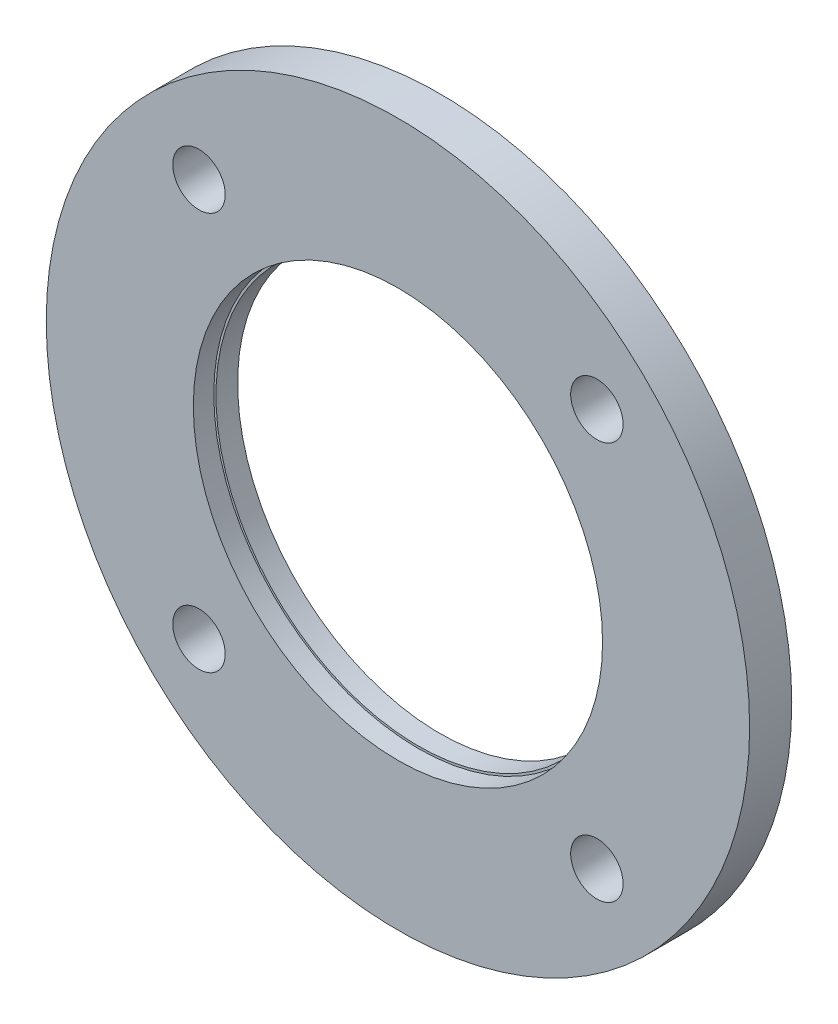
from build123d import *

# Parameters (mm, degrees)
SKETCH2_R          = 2.05
CUT_EXTRUDE1_DEPTH = 40.030122162


with BuildPart() as part:
    # Sketch1 → Revolve1 (revolve)
    with BuildSketch(Plane(origin=(0, 0, 0), x_dir=(1, 0, 0), z_dir=(0, 1, 0))):
        Polygon((-15.83, 0), (-27.5, 0), (-27.5, -3.294), (-16, -3.294), (-16, -1.694), (-15.83, -1.694), align=None)
    revolve(axis=Axis((0, 0, 1.024477222), (0, 0, -1)))

    # Sketch2 → Cut-Extrude1 (cut, through all)
    with BuildSketch(Plane.XY):
        with Locations((-15.556349186, 15.556349186)):
            Circle(SKETCH2_R)
        with Locations((15.556349186, 15.556349186)):
            Circle(SKETCH2_R)
        with Locations((15.556349186, -15.556349186)):
            Circle(SKETCH2_R)
        with Locations((-15.556349186, -15.556349186)):
            Circle(SKETCH2_R)
    extrude(amount=CUT_EXTRUDE1_DEPTH, mode=Mode.SUBTRACT)


solid = part.part
